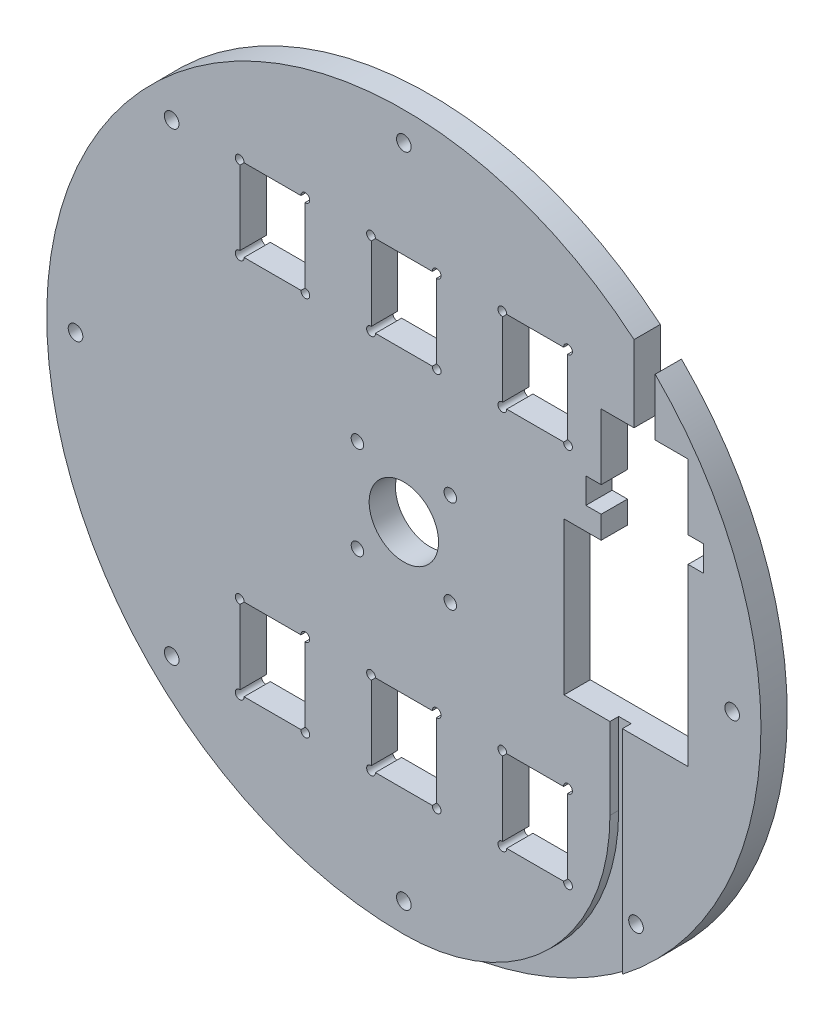
from build123d import *

# Parameters (mm, degrees)
SKETCH1_R              = 81.5
SKETCH1_R_2            = 8
SKETCH1_R_3            = 1.5
SKETCH1_R_4            = 1.75
BOSS_EXTRUDE1_DEPTH    = 6
CUT_EXTRUDE9_DEPTH     = 116.414470497
SKETCH12_W             = 15
SKETCH12_H             = 18.9
CUT_EXTRUDE12_DEPTH    = 116.414470497
SKETCH13_R             = 1
CUT_EXTRUDE13_DEPTH    = 116.414470497
SKETCH14_W             = 5
SKETCH14_H             = 80
CUT_EXTRUDE14_DEPTH    = 116.414470497
CUT_EXTRUDE15_DEPTH    = 2
MOVE_FACE1_OUTLINE_R   = 8
MOVE_FACE1_OUTLINE_R_2 = 7.92
MOVE_FACE1_OUTLINE_R_3 = 1.5
MOVE_FACE1_OUTLINE_R_4 = 1.42
MOVE_FACE1_OUTLINE_R_5 = 1.75
MOVE_FACE1_OUTLINE_R_6 = 1.67
MOVE_FACE1_DEPTH       = 6
MOVE_FACE1_2_OUTLINE_W = 2.84
MOVE_FACE1_2_OUTLINE_H = 0.08
MOVE_FACE1_2_DEPTH     = 4


# Read off the part's stored shape, not the designer's step: Move Face1
with BuildPart() as part:
    # Sketch1 → Boss-Extrude1 (new body)
    with BuildSketch(Plane.XY):
        Circle(SKETCH1_R)
        Circle(SKETCH1_R_2, mode=Mode.SUBTRACT)
        with Locations((10.606601718, -10.606601718)):
            Circle(SKETCH1_R_3, mode=Mode.SUBTRACT)
        with Locations((0, -75)):
            Circle(SKETCH1_R_4, mode=Mode.SUBTRACT)
        with Locations((-10.606601718, -10.606601718)):
            Circle(SKETCH1_R_3, mode=Mode.SUBTRACT)
        with Locations((-10.606601718, 10.606601718)):
            Circle(SKETCH1_R_3, mode=Mode.SUBTRACT)
        with Locations((10.606601718, 10.606601718)):
            Circle(SKETCH1_R_3, mode=Mode.SUBTRACT)
        with Locations((-53.033008589, -53.033008589)):
            Circle(SKETCH1_R_4, mode=Mode.SUBTRACT)
        with Locations((-75, 0)):
            Circle(SKETCH1_R_4, mode=Mode.SUBTRACT)
        with Locations((-53.033008589, 53.033008589)):
            Circle(SKETCH1_R_4, mode=Mode.SUBTRACT)
        with Locations((0, 75)):
            Circle(SKETCH1_R_4, mode=Mode.SUBTRACT)
        with Locations((75, 0)):
            Circle(SKETCH1_R_4, mode=Mode.SUBTRACT)
        with Locations((53.033008589, -53.033008589)):
            Circle(SKETCH1_R_4, mode=Mode.SUBTRACT)
    extrude(amount=BOSS_EXTRUDE1_DEPTH)

    # Sketch11 → Cut-Extrude9 (cut, through all)
    with BuildSketch(Plane.XY.offset(6)):
        Polygon((36.5, -16), (65, -16), (65, 24), (68.5, 24), (68.5, 30), (65, 30), (65, 45), (45, 45), (45, 30), (41.5, 30), (41.5, 24), (45, 24), (45, 19), (36.5, 19), align=None)
    extrude(amount=-CUT_EXTRUDE9_DEPTH, mode=Mode.SUBTRACT)

    # Sketch12 → Cut-Extrude12 (cut, through all)
    with BuildSketch(Plane.XY.offset(6)):
        with Locations((-30, -43.45)):
            Rectangle(SKETCH12_W, SKETCH12_H)
        with Locations((-30, 43.45)):
            Rectangle(SKETCH12_W, SKETCH12_H)
        with Locations((30, 43.45)):
            Rectangle(SKETCH12_W, SKETCH12_H)
        with Locations((0, -43.45)):
            Rectangle(SKETCH12_W, SKETCH12_H)
        with Locations((30, -43.45)):
            Rectangle(SKETCH12_W, SKETCH12_H)
        with Locations((0, 43.45)):
            Rectangle(SKETCH12_W, SKETCH12_H)
    extrude(amount=-CUT_EXTRUDE12_DEPTH, mode=Mode.SUBTRACT)

    # Sketch13 → Cut-Extrude13 (cut, through all)
    with BuildSketch(Plane.XY.offset(6)):
        with Locations((-37.5, 52.9)):
            Circle(SKETCH13_R)
        with Locations((-22.5, 52.9)):
            Circle(SKETCH13_R)
        with Locations((-37.5, 34)):
            Circle(SKETCH13_R)
        with Locations((-22.5, 34)):
            Circle(SKETCH13_R)
        with Locations((-7.5, 52.9)):
            Circle(SKETCH13_R)
        with Locations((-7.5, 34)):
            Circle(SKETCH13_R)
        with Locations((7.5, 52.9)):
            Circle(SKETCH13_R)
        with Locations((7.5, 34)):
            Circle(SKETCH13_R)
        with Locations((22.5, 52.9)):
            Circle(SKETCH13_R)
        with Locations((22.5, 34)):
            Circle(SKETCH13_R)
        with Locations((37.5, 34)):
            Circle(SKETCH13_R)
        with Locations((37.5, 52.9)):
            Circle(SKETCH13_R)
        with Locations((-37.5, -34)):
            Circle(SKETCH13_R)
        with Locations((-22.5, -34)):
            Circle(SKETCH13_R)
        with Locations((-22.5, -52.9)):
            Circle(SKETCH13_R)
        with Locations((-37.5, -52.9)):
            Circle(SKETCH13_R)
        with Locations((-7.5, -34)):
            Circle(SKETCH13_R)
        with Locations((-7.5, -52.9)):
            Circle(SKETCH13_R)
        with Locations((7.5, -52.9)):
            Circle(SKETCH13_R)
        with Locations((7.5, -34)):
            Circle(SKETCH13_R)
        with Locations((22.5, -34)):
            Circle(SKETCH13_R)
        with Locations((37.5, -34)):
            Circle(SKETCH13_R)
        with Locations((37.5, -52.9)):
            Circle(SKETCH13_R)
        with Locations((22.5, -52.9)):
            Circle(SKETCH13_R)
    extrude(amount=-CUT_EXTRUDE13_DEPTH, mode=Mode.SUBTRACT)

    # Sketch14 → Cut-Extrude14 (cut, through all)
    with BuildSketch(Plane.XY.offset(6)):
        with Locations((55, 45)):
            Rectangle(SKETCH14_W, SKETCH14_H)
    extrude(amount=-CUT_EXTRUDE14_DEPTH, mode=Mode.SUBTRACT)

    # Sketch15 → Cut-Extrude15 (cut)
    with BuildSketch(Plane.XY.offset(6)):
        with BuildLine():
            Line((47, -34.5), (47, -16))
            Line((47, -16), (50, -16))
            Line((50, -16), (50, -81.5))
            Line((50, -81.5), (0, -81.5))
            ThreePointArc((0, -81.5), (33.234018716, -67.734018716), (47, -34.5))
        make_face()
    extrude(amount=-CUT_EXTRUDE15_DEPTH, mode=Mode.SUBTRACT)

    # Move Face1 outline → Move Face1 (add)
    # profile 1 of 38: a face of its own
    with BuildSketch(Plane.XY):
        with BuildLine():
            Line((57.42, 44.92), (64.92, 44.92))
            Line((64.92, 44.92), (64.92, 29.92))
            Line((64.92, 29.92), (68.42, 29.92))
            Line((68.42, 29.92), (68.42, 24.08))
            Line((68.42, 24.08), (64.92, 24.08))
            Line((64.92, 24.08), (64.92, -15.92))
            Line((64.92, -15.92), (49.92, -15.92))
            Line((49.92, -15.92), (49.920000001, -64.523561589))
            ThreePointArc((49.920000001, -64.523561589), (81.427464872, -4.986418009), (57.42, 57.950323554))
            Line((57.42, 57.950323554), (57.42, 44.92))
        make_face()
        with BuildLine():
            ThreePointArc((57.5, 57.758116313), (81.346728558, -4.99597369), (50.000000001, -64.36031386))
            Line((50.000000001, -64.36031386), (50, -16))
            Line((50, -16), (65, -16))
            Line((65, -16), (65, 24))
            Line((65, 24), (68.5, 24))
            Line((68.5, 24), (68.5, 30))
            Line((68.5, 30), (65, 30))
            Line((65, 30), (65, 45))
            Line((65, 45), (57.5, 45))
            Line((57.5, 45), (57.5, 57.758116313))
        make_face(mode=Mode.SUBTRACT)
    # profile 2 of 38: a face of its own
    with BuildSketch(Plane.XY):
        with BuildLine():
            ThreePointArc((52.58, 62.37499499), (-76.628481948, 27.988786224), (0, -81.580000001))
            ThreePointArc((0, -81.580000001), (33.290587258, -67.790587258), (47.08, -34.5))
            Line((47.08, -34.5), (47.08, -15.92))
            Line((47.08, -15.92), (36.58, -15.92))
            Line((36.58, -15.92), (36.58, 18.92))
            Line((36.58, 18.92), (45.08, 18.92))
            Line((45.08, 18.92), (45.08, 24.08))
            Line((45.08, 24.08), (41.58, 24.08))
            Line((41.58, 24.08), (41.58, 29.92))
            Line((41.58, 29.92), (45.08, 29.92))
            Line((45.08, 29.92), (45.08, 44.92))
            Line((45.08, 44.92), (52.58, 44.92))
            Line((52.58, 44.92), (52.58, 62.37499499))
        make_face()
        with BuildLine():
            Line((36.5, -16), (47, -16))
            Line((47, -16), (47, -34.5))
            ThreePointArc((47, -34.5), (33.234018716, -67.734018716), (0, -81.5))
            ThreePointArc((0, -81.5), (-76.559714746, 27.943873706), (52.5, 62.337789502))
            Line((52.5, 62.337789502), (52.5, 45))
            Line((52.5, 45), (45, 45))
            Line((45, 45), (45, 30))
            Line((45, 30), (41.5, 30))
            Line((41.5, 30), (41.5, 24))
            Line((41.5, 24), (45, 24))
            Line((45, 24), (45, 19))
            Line((45, 19), (36.5, 19))
            Line((36.5, 19), (36.5, -16))
        make_face(mode=Mode.SUBTRACT)
    # profile 3 of 38: a face of its own
    with BuildSketch(Plane.XY):
        with BuildLine():
            Line((-37.42, -51.903205136), (-37.42, -34.996794864))
            ThreePointArc((-37.42, -34.996794864), (-37.45996791, -34.999198395), (-37.5, -35))
            Line((-37.5, -35), (-37.5, -51.9))
            ThreePointArc((-37.5, -51.9), (-37.45996791, -51.900801605), (-37.42, -51.903205136))
        make_face()
    # profile 4 of 38: a face of its own
    with BuildSketch(Plane.XY):
        with BuildLine():
            Line((-23.5, -34), (-36.5, -34))
            ThreePointArc((-36.5, -34), (-36.500801605, -34.04003209), (-36.503205136, -34.08))
            Line((-36.503205136, -34.08), (-23.496794864, -34.08))
            ThreePointArc((-23.496794864, -34.08), (-23.499198395, -34.04003209), (-23.5, -34))
        make_face()
    # profile 5 of 38: a face of its own
    with BuildSketch(Plane.XY):
        with BuildLine():
            ThreePointArc((-36.503205136, -52.82), (-36.500801605, -52.85996791), (-36.5, -52.9))
            Line((-36.5, -52.9), (-23.5, -52.9))
            ThreePointArc((-23.5, -52.9), (-23.499198395, -52.85996791), (-23.496794864, -52.82))
            Line((-23.496794864, -52.82), (-36.503205136, -52.82))
        make_face()
    # profile 6 of 38: a face of its own
    with BuildSketch(Plane.XY):
        with BuildLine():
            Line((-22.5, -51.9), (-22.5, -35))
            ThreePointArc((-22.5, -35), (-22.54003209, -34.999198395), (-22.58, -34.996794864))
            Line((-22.58, -34.996794864), (-22.58, -51.903205136))
            ThreePointArc((-22.58, -51.903205136), (-22.54003209, -51.900801605), (-22.5, -51.9))
        make_face()
    # profile 7 of 38: a face of its own
    with BuildSketch(Plane.XY):
        with BuildLine():
            Line((-37.42, 34.996794864), (-37.42, 51.903205136))
            ThreePointArc((-37.42, 51.903205136), (-37.45996791, 51.900801605), (-37.5, 51.9))
            Line((-37.5, 51.9), (-37.5, 35))
            ThreePointArc((-37.5, 35), (-37.45996791, 34.999198395), (-37.42, 34.996794864))
        make_face()
    # profile 8 of 38: a face of its own
    with BuildSketch(Plane.XY):
        with BuildLine():
            Line((-23.5, 52.9), (-36.5, 52.9))
            ThreePointArc((-36.5, 52.9), (-36.500801605, 52.85996791), (-36.503205136, 52.82))
            Line((-36.503205136, 52.82), (-23.496794864, 52.82))
            ThreePointArc((-23.496794864, 52.82), (-23.499198395, 52.85996791), (-23.5, 52.9))
        make_face()
    # profile 9 of 38: a face of its own
    with BuildSketch(Plane.XY):
        with BuildLine():
            ThreePointArc((-36.503205136, 34.08), (-36.500801605, 34.04003209), (-36.5, 34))
            Line((-36.5, 34), (-23.5, 34))
            ThreePointArc((-23.5, 34), (-23.499198395, 34.04003209), (-23.496794864, 34.08))
            Line((-23.496794864, 34.08), (-36.503205136, 34.08))
        make_face()
    # profile 10 of 38: a face of its own
    with BuildSketch(Plane.XY):
        with BuildLine():
            Line((-22.5, 35), (-22.5, 51.9))
            ThreePointArc((-22.5, 51.9), (-22.54003209, 51.900801605), (-22.58, 51.903205136))
            Line((-22.58, 51.903205136), (-22.58, 34.996794864))
            ThreePointArc((-22.58, 34.996794864), (-22.54003209, 34.999198395), (-22.5, 35))
        make_face()
    # profile 11 of 38: a face of its own
    with BuildSketch(Plane.XY):
        with BuildLine():
            Line((-6.503205136, -34.08), (6.503205136, -34.08))
            ThreePointArc((6.503205136, -34.08), (6.500801605, -34.04003209), (6.5, -34))
            Line((6.5, -34), (-6.5, -34))
            ThreePointArc((-6.5, -34), (-6.500801605, -34.04003209), (-6.503205136, -34.08))
        make_face()
    # profile 12 of 38: a face of its own
    with BuildSketch(Plane.XY):
        with BuildLine():
            Line((7.5, -51.9), (7.5, -35))
            ThreePointArc((7.5, -35), (7.45996791, -34.999198395), (7.42, -34.996794864))
            Line((7.42, -34.996794864), (7.42, -51.903205136))
            ThreePointArc((7.42, -51.903205136), (7.45996791, -51.900801605), (7.5, -51.9))
        make_face()
    # profile 13 of 38: a face of its own
    with BuildSketch(Plane.XY):
        with BuildLine():
            ThreePointArc((-7.42, -34.996794864), (-7.45996791, -34.999198395), (-7.5, -35))
            Line((-7.5, -35), (-7.5, -51.9))
            ThreePointArc((-7.5, -51.9), (-7.45996791, -51.900801605), (-7.42, -51.903205136))
            Line((-7.42, -51.903205136), (-7.42, -34.996794864))
        make_face()
    # profile 14 of 38: a face of its own
    with BuildSketch(Plane.XY):
        with BuildLine():
            Line((-6.5, -52.9), (6.5, -52.9))
            ThreePointArc((6.5, -52.9), (6.500801605, -52.85996791), (6.503205136, -52.82))
            Line((6.503205136, -52.82), (-6.503205136, -52.82))
            ThreePointArc((-6.503205136, -52.82), (-6.500801605, -52.85996791), (-6.5, -52.9))
        make_face()
    # profile 15 of 38: a face of its own
    with BuildSketch(Plane.XY):
        with BuildLine():
            Line((23.496794864, -34.08), (36.503205136, -34.08))
            ThreePointArc((36.503205136, -34.08), (36.500801605, -34.04003209), (36.5, -34))
            Line((36.5, -34), (23.5, -34))
            ThreePointArc((23.5, -34), (23.499198395, -34.04003209), (23.496794864, -34.08))
        make_face()
    # profile 16 of 38: a face of its own
    with BuildSketch(Plane.XY):
        with BuildLine():
            Line((37.5, -51.9), (37.5, -35))
            ThreePointArc((37.5, -35), (37.45996791, -34.999198395), (37.42, -34.996794864))
            Line((37.42, -34.996794864), (37.42, -51.903205136))
            ThreePointArc((37.42, -51.903205136), (37.45996791, -51.900801605), (37.5, -51.9))
        make_face()
    # profile 17 of 38: a face of its own
    with BuildSketch(Plane.XY):
        with BuildLine():
            ThreePointArc((22.58, -34.996794864), (22.54003209, -34.999198395), (22.5, -35))
            Line((22.5, -35), (22.5, -51.9))
            ThreePointArc((22.5, -51.9), (22.54003209, -51.900801605), (22.58, -51.903205136))
            Line((22.58, -51.903205136), (22.58, -34.996794864))
        make_face()
    # profile 18 of 38: a face of its own
    with BuildSketch(Plane.XY):
        with BuildLine():
            Line((23.5, -52.9), (36.5, -52.9))
            ThreePointArc((36.5, -52.9), (36.500801605, -52.85996791), (36.503205136, -52.82))
            Line((36.503205136, -52.82), (23.496794864, -52.82))
            ThreePointArc((23.496794864, -52.82), (23.499198395, -52.85996791), (23.5, -52.9))
        make_face()
    # profile 19 of 38: a face of its own
    with BuildSketch(Plane.XY):
        with BuildLine():
            Line((23.496794864, 52.82), (36.503205136, 52.82))
            ThreePointArc((36.503205136, 52.82), (36.500801605, 52.85996791), (36.5, 52.9))
            Line((36.5, 52.9), (23.5, 52.9))
            ThreePointArc((23.5, 52.9), (23.499198395, 52.85996791), (23.496794864, 52.82))
        make_face()
    # profile 20 of 38: a face of its own
    with BuildSketch(Plane.XY):
        with BuildLine():
            Line((37.5, 35), (37.5, 51.9))
            ThreePointArc((37.5, 51.9), (37.45996791, 51.900801605), (37.42, 51.903205136))
            Line((37.42, 51.903205136), (37.42, 34.996794864))
            ThreePointArc((37.42, 34.996794864), (37.45996791, 34.999198395), (37.5, 35))
        make_face()
    # profile 21 of 38: a face of its own
    with BuildSketch(Plane.XY):
        with BuildLine():
            ThreePointArc((22.58, 51.903205136), (22.54003209, 51.900801605), (22.5, 51.9))
            Line((22.5, 51.9), (22.5, 35))
            ThreePointArc((22.5, 35), (22.54003209, 34.999198395), (22.58, 34.996794864))
            Line((22.58, 34.996794864), (22.58, 51.903205136))
        make_face()
    # profile 22 of 38: a face of its own
    with BuildSketch(Plane.XY):
        with BuildLine():
            Line((23.5, 34), (36.5, 34))
            ThreePointArc((36.5, 34), (36.500801605, 34.04003209), (36.503205136, 34.08))
            Line((36.503205136, 34.08), (23.496794864, 34.08))
            ThreePointArc((23.496794864, 34.08), (23.499198395, 34.04003209), (23.5, 34))
        make_face()
    # profile 23 of 38: a face of its own
    with BuildSketch(Plane.XY):
        with BuildLine():
            Line((-6.503205136, 52.82), (6.503205136, 52.82))
            ThreePointArc((6.503205136, 52.82), (6.500801605, 52.85996791), (6.5, 52.9))
            Line((6.5, 52.9), (-6.5, 52.9))
            ThreePointArc((-6.5, 52.9), (-6.500801605, 52.85996791), (-6.503205136, 52.82))
        make_face()
    # profile 24 of 38: a face of its own
    with BuildSketch(Plane.XY):
        with BuildLine():
            Line((7.5, 35), (7.5, 51.9))
            ThreePointArc((7.5, 51.9), (7.45996791, 51.900801605), (7.42, 51.903205136))
            Line((7.42, 51.903205136), (7.42, 34.996794864))
            ThreePointArc((7.42, 34.996794864), (7.45996791, 34.999198395), (7.5, 35))
        make_face()
    # profile 25 of 38: a face of its own
    with BuildSketch(Plane.XY):
        with BuildLine():
            ThreePointArc((-7.42, 51.903205136), (-7.45996791, 51.900801605), (-7.5, 51.9))
            Line((-7.5, 51.9), (-7.5, 35))
            ThreePointArc((-7.5, 35), (-7.45996791, 34.999198395), (-7.42, 34.996794864))
            Line((-7.42, 34.996794864), (-7.42, 51.903205136))
        make_face()
    # profile 26 of 38: a face of its own
    with BuildSketch(Plane.XY):
        with BuildLine():
            Line((-6.5, 34), (6.5, 34))
            ThreePointArc((6.5, 34), (6.500801605, 34.04003209), (6.503205136, 34.08))
            Line((6.503205136, 34.08), (-6.503205136, 34.08))
            ThreePointArc((-6.503205136, 34.08), (-6.500801605, 34.04003209), (-6.5, 34))
        make_face()
    # profile 27 of 38: a face of its own
    with BuildSketch(Plane.XY):
        Circle(MOVE_FACE1_OUTLINE_R)
        Circle(MOVE_FACE1_OUTLINE_R_2, mode=Mode.SUBTRACT)
    # profile 28 of 38: a face of its own
    with BuildSketch(Plane.XY):
        with Locations((10.606601718, -10.606601718)):
            Circle(MOVE_FACE1_OUTLINE_R_3)
        with Locations((10.606601718, -10.606601718)):
            Circle(MOVE_FACE1_OUTLINE_R_4, mode=Mode.SUBTRACT)
    # profile 29 of 38: a face of its own
    with BuildSketch(Plane.XY):
        with Locations((0, -75)):
            Circle(MOVE_FACE1_OUTLINE_R_5)
        with Locations((0, -75)):
            Circle(MOVE_FACE1_OUTLINE_R_6, mode=Mode.SUBTRACT)
    # profile 30 of 38: a face of its own
    with BuildSketch(Plane.XY):
        with Locations((-10.606601718, -10.606601718)):
            Circle(MOVE_FACE1_OUTLINE_R_3)
        with Locations((-10.606601718, -10.606601718)):
            Circle(MOVE_FACE1_OUTLINE_R_4, mode=Mode.SUBTRACT)
    # profile 31 of 38: a face of its own
    with BuildSketch(Plane.XY):
        with Locations((-10.606601718, 10.606601718)):
            Circle(MOVE_FACE1_OUTLINE_R_3)
        with Locations((-10.606601718, 10.606601718)):
            Circle(MOVE_FACE1_OUTLINE_R_4, mode=Mode.SUBTRACT)
    # profile 32 of 38: a face of its own
    with BuildSketch(Plane.XY):
        with Locations((10.606601718, 10.606601718)):
            Circle(MOVE_FACE1_OUTLINE_R_3)
        with Locations((10.606601718, 10.606601718)):
            Circle(MOVE_FACE1_OUTLINE_R_4, mode=Mode.SUBTRACT)
    # profile 33 of 38: a face of its own
    with BuildSketch(Plane.XY):
        with Locations((-53.033008589, -53.033008589)):
            Circle(MOVE_FACE1_OUTLINE_R_5)
        with Locations((-53.033008589, -53.033008589)):
            Circle(MOVE_FACE1_OUTLINE_R_6, mode=Mode.SUBTRACT)
    # profile 34 of 38: a face of its own
    with BuildSketch(Plane.XY):
        with Locations((-75, 0)):
            Circle(MOVE_FACE1_OUTLINE_R_5)
        with Locations((-75, 0)):
            Circle(MOVE_FACE1_OUTLINE_R_6, mode=Mode.SUBTRACT)
    # profile 35 of 38: a face of its own
    with BuildSketch(Plane.XY):
        with Locations((-53.033008589, 53.033008589)):
            Circle(MOVE_FACE1_OUTLINE_R_5)
        with Locations((-53.033008589, 53.033008589)):
            Circle(MOVE_FACE1_OUTLINE_R_6, mode=Mode.SUBTRACT)
    # profile 36 of 38: a face of its own
    with BuildSketch(Plane.XY):
        with Locations((0, 75)):
            Circle(MOVE_FACE1_OUTLINE_R_5)
        with Locations((0, 75)):
            Circle(MOVE_FACE1_OUTLINE_R_6, mode=Mode.SUBTRACT)
    # profile 37 of 38: a face of its own
    with BuildSketch(Plane.XY):
        with Locations((75, 0)):
            Circle(MOVE_FACE1_OUTLINE_R_5)
        with Locations((75, 0)):
            Circle(MOVE_FACE1_OUTLINE_R_6, mode=Mode.SUBTRACT)
    # profile 38 of 38: a face of its own
    with BuildSketch(Plane.XY):
        with Locations((53.033008589, -53.033008589)):
            Circle(MOVE_FACE1_OUTLINE_R_5)
        with Locations((53.033008589, -53.033008589)):
            Circle(MOVE_FACE1_OUTLINE_R_6, mode=Mode.SUBTRACT)
    extrude(amount=MOVE_FACE1_DEPTH)

    # Move Face1 2 outline → Move Face1 2 (add)
    with BuildSketch(Plane.XY):
        with BuildLine():
            ThreePointArc((0, -81.580000001), (26.376734499, -77.198214211), (49.920000001, -64.523561589))
            Line((49.920000001, -64.523561589), (49.92, -64.422384311))
            ThreePointArc((49.92, -64.422384311), (28.366135012, -76.404269414), (4.215193725, -81.390921742))
            ThreePointArc((4.215193725, -81.390921742), (2.109716137, -81.532706682), (0, -81.580000001))
        make_face()
        with Locations((48.5, -15.96)):
            Rectangle(MOVE_FACE1_2_OUTLINE_W, MOVE_FACE1_2_OUTLINE_H)
    extrude(amount=MOVE_FACE1_2_DEPTH)


solid = part.part
